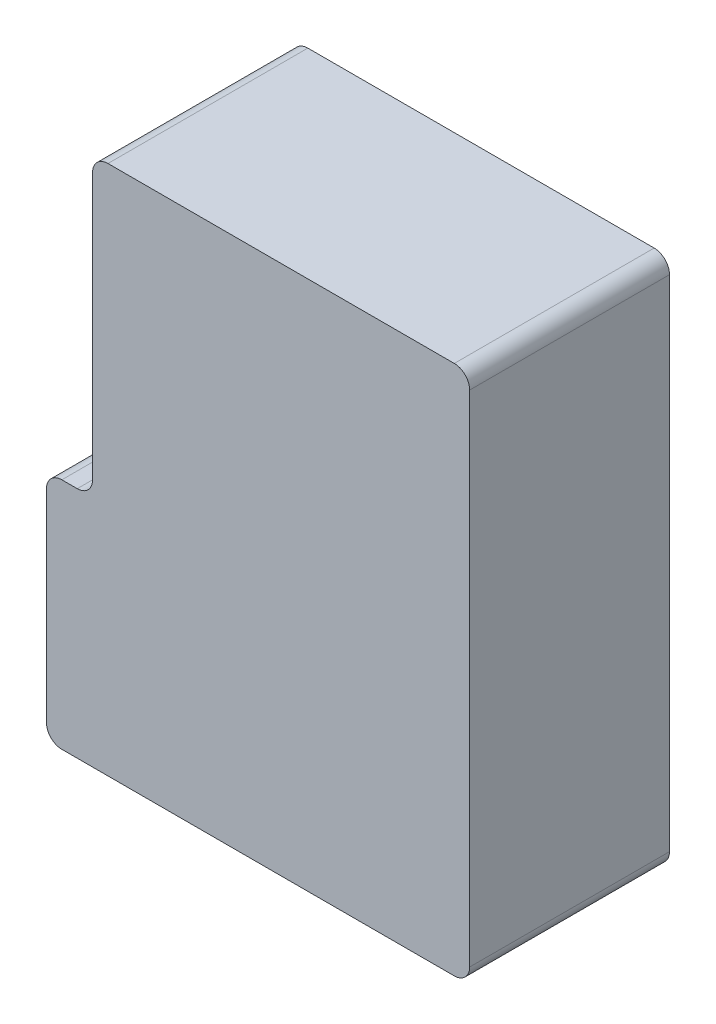
from build123d import *

# Parameters (mm, degrees)
BOSS_EXTRUDE1_DEPTH = 63.5
SHELL1_T            = 2.54
BOSS_EXTRUDE2_DEPTH = 63.5
SKETCH7_R           = 6.35
BOSS_EXTRUDE3_DEPTH = 6.269999906
SKETCH8_R           = 2.625
CUT_EXTRUDE1_DEPTH  = 10
FILLET1_R           = 5.08
FILLET2_R           = 2
SKETCH9_R           = 2.625
CUT_EXTRUDE2_DEPTH  = 6.269999906
SKETCH12_R          = 1.085
CUT_EXTRUDE3_DEPTH  = 2.54


with BuildPart() as part:
    # Sketch3 → Boss-Extrude1 (new body)
    with BuildSketch(Plane.XY):
        Polygon((23.724299403, 135.532318995), (143.231302272, 135.532318995), (143.231302272, -34.647679937), (8.484299403, -34.647679937), (8.484299403, 37.400302972), (23.724299403, 37.400302972), (23.724299403, 48.156317408), align=None)
    extrude(amount=BOSS_EXTRUDE1_DEPTH)

    # Shell1
    shell1_openings = [part.faces().sort_by_distance(p)[0] for p in [
        (80.026697364, 47.928989109, 0),
    ]]
    offset(amount=SHELL1_T, openings=shell1_openings, kind=Kind.INTERSECTION)

    # Sketch6 → Boss-Extrude2 (add)
    with BuildSketch(Plane(origin=(0, 0, 63.5), x_dir=(-1, 0, 0), z_dir=(0, 0, -1))):
        with BuildLine():
            Line((-125.945565206, -28.297679937), (-125.945565206, -34.647679937))
            Line((-125.945565206, -34.647679937), (-113.245565206, -34.647679937))
            Line((-113.245565206, -34.647679937), (-113.245565206, -28.297679937))
            ThreePointArc((-113.245565206, -28.297679937), (-119.595565206, -21.947679937), (-125.945565206, -28.297679937))
        make_face()
        with BuildLine():
            Line((-136.881302272, -2.897679937), (-143.231302272, -2.897679937))
            Line((-143.231302272, -2.897679937), (-143.231302272, -15.597679937))
            Line((-143.231302272, -15.597679937), (-136.881302272, -15.597679937))
            ThreePointArc((-136.881302272, -15.597679937), (-130.531302272, -9.247679937), (-136.881302272, -2.897679937))
        make_face()
        with BuildLine():
            Line((-38.470036469, -28.297679937), (-38.470036469, -34.647679937))
            Line((-38.470036469, -34.647679937), (-25.770036469, -34.647679937))
            Line((-25.770036469, -34.647679937), (-25.770036469, -28.297679937))
            ThreePointArc((-25.770036469, -28.297679937), (-32.120036469, -21.947679937), (-38.470036469, -28.297679937))
        make_face()
        with BuildLine():
            Line((-14.834299403, -2.897679937), (-8.484299403, -2.897679937))
            Line((-8.484299403, -2.897679937), (-8.484299403, -15.597679937))
            Line((-8.484299403, -15.597679937), (-14.834299403, -15.597679937))
            ThreePointArc((-14.834299403, -15.597679937), (-21.184299403, -9.247679937), (-14.834299403, -2.897679937))
        make_face()
        with BuildLine():
            Line((-14.834299403, 24.700302972), (-8.484299403, 24.700302972))
            Line((-8.484299403, 24.700302972), (-8.484299403, 37.400302972))
            Line((-8.484299403, 37.400302972), (-14.834299403, 37.400302972))
            ThreePointArc((-14.834299403, 37.400302972), (-21.184299403, 31.050302972), (-14.834299403, 24.700302972))
        make_face()
        with BuildLine():
            Line((-136.881302272, 56.792319529), (-143.231302272, 56.792319529))
            Line((-143.231302272, 56.792319529), (-143.231302272, 44.092319529))
            Line((-143.231302272, 44.092319529), (-136.881302272, 44.092319529))
            ThreePointArc((-136.881302272, 44.092319529), (-130.531302272, 50.442319529), (-136.881302272, 56.792319529))
        make_face()
        with BuildLine():
            Line((-136.881302272, 116.482318995), (-143.231302272, 116.482318995))
            Line((-143.231302272, 116.482318995), (-143.231302272, 103.782318995))
            Line((-143.231302272, 103.782318995), (-136.881302272, 103.782318995))
            ThreePointArc((-136.881302272, 103.782318995), (-130.531302272, 110.132318995), (-136.881302272, 116.482318995))
        make_face()
        with BuildLine():
            Line((-125.945565206, 129.182318995), (-125.945565206, 135.532318995))
            Line((-125.945565206, 135.532318995), (-113.245565206, 135.532318995))
            Line((-113.245565206, 135.532318995), (-113.245565206, 129.182318995))
            ThreePointArc((-113.245565206, 129.182318995), (-119.595565206, 122.832318995), (-125.945565206, 129.182318995))
        make_face()
        with BuildLine():
            Line((-38.470036469, 129.182318995), (-38.470036469, 135.532318995))
            Line((-38.470036469, 135.532318995), (-23.724299403, 135.532318995))
            Line((-23.724299403, 135.532318995), (-23.724299403, 129.182318995))
            Line((-23.724299403, 129.182318995), (-25.770036469, 129.182318995))
            ThreePointArc((-25.770036469, 129.182318995), (-32.120036469, 122.832318995), (-38.470036469, 129.182318995))
        make_face()
        with BuildLine():
            Line((-82.207800837, 129.182318995), (-82.207800837, 135.532318995))
            Line((-82.207800837, 135.532318995), (-69.507800837, 135.532318995))
            Line((-69.507800837, 135.532318995), (-69.507800837, 129.182318995))
            ThreePointArc((-69.507800837, 129.182318995), (-75.857800837, 122.832318995), (-82.207800837, 129.182318995))
        make_face()
        with BuildLine():
            Line((-82.207800837, -28.297679937), (-82.207800837, -34.647679937))
            Line((-82.207800837, -34.647679937), (-69.507800837, -34.647679937))
            Line((-69.507800837, -34.647679937), (-69.507800837, -28.297679937))
            ThreePointArc((-69.507800837, -28.297679937), (-75.857800837, -21.947679937), (-82.207800837, -28.297679937))
        make_face()
    extrude(amount=BOSS_EXTRUDE2_DEPTH)

    # Sketch7 → Boss-Extrude3 (add)
    with BuildSketch(Plane(origin=(0, 0, 63.5), x_dir=(-1, 0, 0), z_dir=(0, 0, -1))):
        with Locations(Location((-123.089417804, 112.925318995, 0), (0, 0, 180))):
            Circle(SKETCH7_R)
        with Locations(Location((-32.847417804, 113.942318995, 0), (0, 0, 180))):
            Circle(SKETCH7_R)
        with Locations(Location((-120.61930215, 28.818320338, 0), (0, 0, 180))):
            Circle(SKETCH7_R)
        with Locations(Location((-31.97930215, 39.393320338, 0), (0, 0, 180))):
            Circle(SKETCH7_R)
        with Locations(Location((-31.97930215, 18.438320338, 0), (0, 0, 180))):
            Circle(SKETCH7_R)
        with Locations(Location((-33.863417804, 52.982318995, 0), (0, 0, 180))):
            Circle(SKETCH7_R)
        with Locations(Location((-123.271417804, 51.966318995, 0), (0, 0, 180))):
            Circle(SKETCH7_R)
    extrude(amount=BOSS_EXTRUDE3_DEPTH)

    # Sketch8 → Cut-Extrude1 (cut)
    with BuildSketch(Plane(origin=(0, 0, 0), x_dir=(-1, 0, 0), z_dir=(0, 0, -1))):
        with Locations((-119.595565206, 129.182318995)):
            Circle(SKETCH8_R)
        with Locations((-136.881302272, 110.132318995)):
            Circle(SKETCH8_R)
        with Locations((-75.857800837, 129.182318995)):
            Circle(SKETCH8_R)
        with Locations((-32.120036469, 129.182318995)):
            Circle(SKETCH8_R)
        with Locations((-136.881302272, 50.442319529)):
            Circle(SKETCH8_R)
        with Locations((-136.881302272, -9.247679937)):
            Circle(SKETCH8_R)
        with Locations((-119.595565206, -28.297679937)):
            Circle(SKETCH8_R)
        with Locations((-75.857800837, -28.297679937)):
            Circle(SKETCH8_R)
        with Locations((-32.120036469, -28.297679937)):
            Circle(SKETCH8_R)
        with Locations((-14.834299403, -9.247679937)):
            Circle(SKETCH8_R)
        with Locations((-14.834299403, 31.050302972)):
            Circle(SKETCH8_R)
    extrude(amount=-CUT_EXTRUDE1_DEPTH, mode=Mode.SUBTRACT)

    # Fillet1
    # the kernel refuses this fillet: 5.08 mm, written as the material it adds along each edge
    with BuildSketch(Plane(origin=(21.184299403, 39.940302972, 0), x_dir=(-1, 0, 0), z_dir=(0, 0, 1))) as fillet1_piece_1:
        with BuildLine():
            CenterArc((FILLET1_R, -FILLET1_R), FILLET1_R, 90, 90)
            Line((0, -FILLET1_R), (0, 0))
            Line((0, 0), (FILLET1_R, 0))
        make_face()
    extrude(amount=66.04)
    with BuildSketch(Plane(origin=(23.724299403, 129.182318995, 73.685666536), x_dir=(1, 0, 0), z_dir=(0, 0, -1))) as fillet1_piece_2_section:
        with BuildLine():
            CenterArc((5.08, 4.074266614), FILLET1_R, 180, 53.323528098)
            Line((0, 4.074266614), (0, 0))
            Line((0, 0), (2.045737066, 0))
        make_face()
    fillet1_piece_2 = extrude(amount=73.685666536, mode=Mode.PRIVATE)
    fillet1_piece_2 = split(fillet1_piece_2, bisect_by=Plane(origin=(23.724299403, 129.182318995, 66.04), z_dir=(0, 0, -1)), keep=Keep.TOP, mode=Mode.PRIVATE)
    add(fillet1_piece_2)
    with BuildSketch(Plane(origin=(143.231302272, 135.532318995, 0), x_dir=(-1, 0, 0), z_dir=(0, 0, 1))) as fillet1_piece_3_section:
        with BuildLine():
            CenterArc((FILLET1_R, FILLET1_R), FILLET1_R, 180, 90)
            Line((0, FILLET1_R), (0, 0))
            Line((0, 0), (FILLET1_R, 0))
        make_face()
    fillet1_piece_3 = extrude(amount=76.2, mode=Mode.PRIVATE)
    fillet1_piece_3 = split(fillet1_piece_3, bisect_by=Plane(origin=(143.231302272, 135.532318995, 66.04), z_dir=(0, 0, -1)), keep=Keep.TOP, mode=Mode.PRIVATE)
    add(fillet1_piece_3)
    with BuildSketch(Plane(origin=(143.231302272, -34.647679937, 0), x_dir=(0, 1, 0), z_dir=(0, 0, 1))) as fillet1_piece_4_section:
        with BuildLine():
            CenterArc((FILLET1_R, FILLET1_R), FILLET1_R, 180, 90)
            Line((0, FILLET1_R), (0, 0))
            Line((0, 0), (FILLET1_R, 0))
        make_face()
    fillet1_piece_4 = extrude(amount=76.2, mode=Mode.PRIVATE)
    fillet1_piece_4 = split(fillet1_piece_4, bisect_by=Plane(origin=(143.231302272, -34.647679937, 66.04), z_dir=(0, 0, -1)), keep=Keep.TOP, mode=Mode.PRIVATE)
    add(fillet1_piece_4)
    with BuildSketch(Plane(origin=(8.484299403, -34.647679937, 0), x_dir=(0, 1, 0), z_dir=(0, 0, 1))) as fillet1_piece_5_section:
        with BuildLine():
            CenterArc((FILLET1_R, -FILLET1_R), FILLET1_R, 90, 90)
            Line((0, -FILLET1_R), (0, 0))
            Line((0, 0), (FILLET1_R, 0))
        make_face()
    fillet1_piece_5 = extrude(amount=76.2, mode=Mode.PRIVATE)
    fillet1_piece_5 = split(fillet1_piece_5, bisect_by=Plane(origin=(8.484299403, -34.647679937, 66.04), z_dir=(0, 0, -1)), keep=Keep.TOP, mode=Mode.PRIVATE)
    add(fillet1_piece_5)
    # the kernel refuses this fillet: 5.08 mm, written as the material it takes off along each edge
    with BuildSketch(Plane(origin=(21.184299403, 138.072318995, -12.7), x_dir=(0, -1, 0), z_dir=(0, 0, 1))) as fillet1_2_piece_1:
        with BuildLine():
            CenterArc((FILLET1_R, FILLET1_R), FILLET1_R, 180, 90)
            Line((0, FILLET1_R), (0, 0))
            Line((0, 0), (FILLET1_R, 0))
        make_face()
    extrude(amount=91.44, mode=Mode.SUBTRACT)
    with BuildSketch(Plane(origin=(145.771302272, 138.072318995, 78.74), x_dir=(-1, 0, 0), z_dir=(0, 0, -1)), Plane(origin=(145.771302272, -37.187679937, -12.7), x_dir=(-1, 0, 0), z_dir=(0, 0, 1)), Plane(origin=(5.944299403, -37.187679937, -12.7), x_dir=(0, 1, 0), z_dir=(0, 0, 1)), Plane(origin=(5.944299403, 39.940302972, -12.7), x_dir=(1, 0, 0), z_dir=(0, 0, 1))) as fillet1_2_piece_2:
        with BuildLine():
            CenterArc((FILLET1_R, -FILLET1_R), FILLET1_R, 90, 90)
            Line((0, -FILLET1_R), (0, 0))
            Line((0, 0), (FILLET1_R, 0))
        make_face()
    extrude(amount=91.44, mode=Mode.SUBTRACT)
    with BuildSketch(Plane(origin=(23.724299403, 37.400302972, -12.7), x_dir=(0, 1, 0), z_dir=(0, 0, 1))) as fillet1_2_piece_3:
        with BuildLine():
            CenterArc((FILLET1_R, FILLET1_R), FILLET1_R, 180, 90)
            Line((0, FILLET1_R), (0, 0))
            Line((0, 0), (FILLET1_R, 0))
        make_face()
    extrude(amount=76.2, mode=Mode.SUBTRACT)

    # Fillet2
    fillet2_edges = [part.edges().sort_by_distance(p)[0] for p in [
        (69.507800837, -34.647679937, 31.75),
        (82.207800837, -34.647679937, 31.75),
        (113.245565206, -34.647679937, 31.75),
        (125.945565206, -34.647679937, 31.75),
        (143.231302272, -15.597679937, 31.75),
        (143.231302272, -2.897679937, 31.75),
        (143.231302272, 44.092319529, 31.75),
        (143.231302272, 56.792319529, 31.75),
        (143.231302272, 103.782318995, 31.75),
        (143.231302272, 116.482318995, 31.75),
        (113.245565206, 135.532318995, 31.75),
        (125.945565206, 135.532318995, 31.75),
        (82.207800837, 135.532318995, 31.75),
        (69.507800837, 135.532318995, 31.75),
        (38.470036469, 135.532318995, 31.75),
        (14.834299403, 37.400302972, 31.75),
        (8.484299403, 24.700302972, 31.75),
        (8.484299403, -15.597679937, 31.75),
        (8.484299403, -2.897679937, 31.75),
        (38.470036469, -34.647679937, 31.75),
        (25.770036469, -34.647679937, 31.75),
    ]]
    fillet(fillet2_edges, radius=FILLET2_R)

    # Sketch9 → Cut-Extrude2 (cut)
    with BuildSketch(Plane(origin=(0, 0, 57.230000094), x_dir=(-1, 0, 0), z_dir=(0, 0, -1))):
        with Locations((-123.089417804, 112.925318995)):
            Circle(SKETCH9_R)
        with Locations((-32.847417804, 113.942318995)):
            Circle(SKETCH9_R)
        with Locations((-123.271417804, 51.966318995)):
            Circle(SKETCH9_R)
        with Locations((-33.863417804, 52.982318995)):
            Circle(SKETCH9_R)
        with Locations((-31.97930215, 39.393320338)):
            Circle(SKETCH9_R)
        with Locations((-31.97930215, 18.438320338)):
            Circle(SKETCH9_R)
        with Locations((-120.61930215, 28.818320338)):
            Circle(SKETCH9_R)
    extrude(amount=-CUT_EXTRUDE2_DEPTH, mode=Mode.SUBTRACT)

    # Sketch12 → Cut-Extrude3 (cut)
    with BuildSketch(Plane.ZY.offset(-21.184299403)):
        with Locations(Location((35.328847832, 64.455276398, 0), (0, 0, 270))):
            Circle(SKETCH12_R)
        with Locations(Location((35.328847832, 91.855276398, 0), (0, 0, 270))):
            Circle(SKETCH12_R)
        with Locations(Location((53.428847832, 62.955276398, 0), (0, 0, 270))):
            Circle(SKETCH12_R)
        with Locations(Location((53.428847832, 93.355276398, 0), (0, 0, 270))):
            Circle(SKETCH12_R)
        with BuildLine():
            Line((58.182848583, 72.551276555), (58.182848583, 83.759276631))
            ThreePointArc((58.182848583, 83.759276631), (56.322976643, 88.249404691), (51.832848583, 90.109276631))
            Line((51.832848583, 90.109276631), (40.424848684, 90.109276631))
            ThreePointArc((40.424848684, 90.109276631), (35.934720624, 88.249404691), (34.074848684, 83.759276631))
            Line((34.074848684, 83.759276631), (34.074848684, 83.696676631))
            ThreePointArc((34.074848684, 83.696676631), (33.926058929, 83.337466386), (33.566848684, 83.188676631))
            Line((33.566848684, 83.188676631), (33.065448535, 83.188676631))
            ThreePointArc((33.065448535, 83.188676631), (32.167422923, 82.816702243), (31.795448535, 81.918676631))
            Line((31.795448535, 81.918676631), (31.795448535, 74.391876555))
            ThreePointArc((31.795448535, 74.391876555), (32.167422923, 73.493850943), (33.065448535, 73.121876555))
            Line((33.065448535, 73.121876555), (33.566848684, 73.121876555))
            ThreePointArc((33.566848684, 73.121876555), (33.926058929, 72.9730868), (34.074848684, 72.613876555))
            Line((34.074848684, 72.613876555), (34.074848684, 72.551276555))
            ThreePointArc((34.074848684, 72.551276555), (35.934720624, 68.061148495), (40.424848684, 66.201276555))
            Line((40.424848684, 66.201276555), (51.832848583, 66.201276555))
            ThreePointArc((51.832848583, 66.201276555), (56.322976643, 68.061148495), (58.182848583, 72.551276555))
        make_face()
    extrude(amount=-CUT_EXTRUDE3_DEPTH, mode=Mode.SUBTRACT)


solid = part.part
